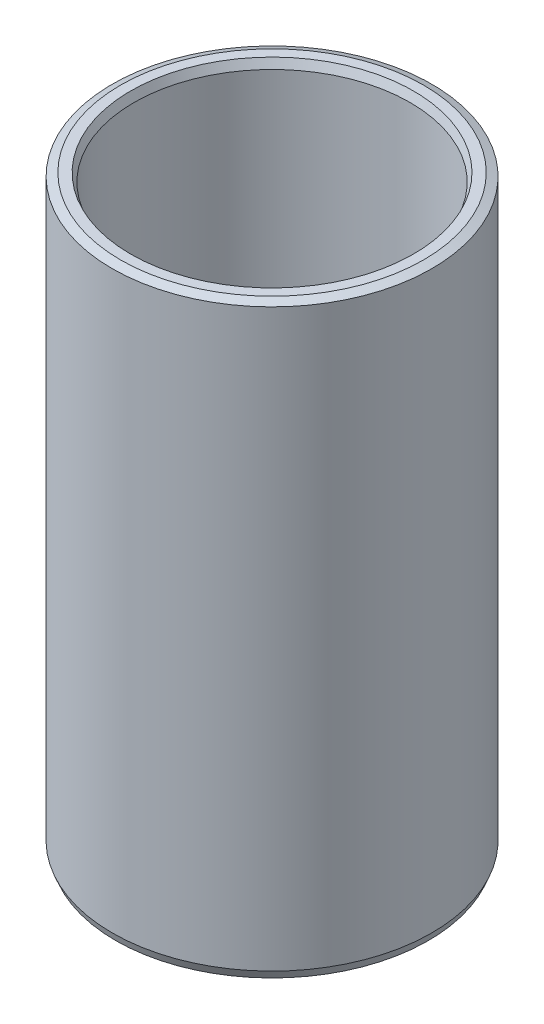
from build123d import *
from OCP.BRepFilletAPI import BRepFilletAPI_MakeChamfer

# Parameters (mm, degrees)
SKETCH1_R           = 60
BOSS_EXTRUDE1_DEPTH = 220.38220053
SKETCH2_R           = 51.820245908
CUT_EXTRUDE1_DEPTH  = 237.153158586
CHAMFER1_SIZE       = 1.266203158
CHAMFER1_SIZE2      = 3.128171132


with BuildPart() as part:
    # Sketch1 → Boss-Extrude1 (new body)
    with BuildSketch(Plane(origin=(0, 0, 0), x_dir=(1, 0, 0), z_dir=(0, 1, 0))):
        Circle(SKETCH1_R)
    extrude(amount=BOSS_EXTRUDE1_DEPTH)

    # Sketch2 → Cut-Extrude1 (cut, through all)
    with BuildSketch(Plane(origin=(0, 0, 0), x_dir=(1, 0, 0), z_dir=(0, 1, 0))):
        Circle(SKETCH2_R)
    extrude(amount=CUT_EXTRUDE1_DEPTH, mode=Mode.SUBTRACT)

    # Chamfer1: one chamfer whose edges measure the first distance from different faces: ONE call of the kernel's chamfer builder (chamfer() names one face for all edges)
    chamfer1_edges_1 = [part.edges().sort_by_distance(p)[0] for p in [
        (-51.820245908, 220.38220053, 0),
    ]]
    chamfer1_side_1 = [part.faces().sort_by_distance(p)[0] for p in [
        (-58.302943725, 220.38220053, 0),
    ]]
    chamfer1_edges_2 = [part.edges().sort_by_distance(p)[0] for p in [
        (-51.820245908, 0, 0),
    ]]
    chamfer1_side_2 = [part.faces().sort_by_distance(p)[0] for p in [
        (-51.820245908, 110.191100265, 0),
    ]]
    chamfer1_edges_3 = [part.edges().sort_by_distance(p)[0] for p in [
        (-60, 0, 0),
    ]]
    chamfer1_side_3 = [part.faces().sort_by_distance(p)[0] for p in [
        (-58.302943725, 0, 0),
    ]]
    chamfer1_edges_4 = [part.edges().sort_by_distance(p)[0] for p in [
        (-60, 220.38220053, 0),
    ]]
    chamfer1_side_4 = [part.faces().sort_by_distance(p)[0] for p in [
        (-60, 110.191100265, 0),
    ]]
    chamfer1 = BRepFilletAPI_MakeChamfer(part.part.solid().wrapped)
    for e in chamfer1_edges_1:
        chamfer1.Add(CHAMFER1_SIZE, CHAMFER1_SIZE2, e.wrapped, chamfer1_side_1[0].wrapped)  # the first distance lies on this face
    for e in chamfer1_edges_2:
        chamfer1.Add(CHAMFER1_SIZE, CHAMFER1_SIZE2, e.wrapped, chamfer1_side_2[0].wrapped)  # the first distance lies on this face
    for e in chamfer1_edges_3:
        chamfer1.Add(CHAMFER1_SIZE, CHAMFER1_SIZE2, e.wrapped, chamfer1_side_3[0].wrapped)  # the first distance lies on this face
    for e in chamfer1_edges_4:
        chamfer1.Add(CHAMFER1_SIZE, CHAMFER1_SIZE2, e.wrapped, chamfer1_side_4[0].wrapped)  # the first distance lies on this face
    add(Compound.cast(chamfer1.Shape()), mode=Mode.REPLACE)


solid = part.part
